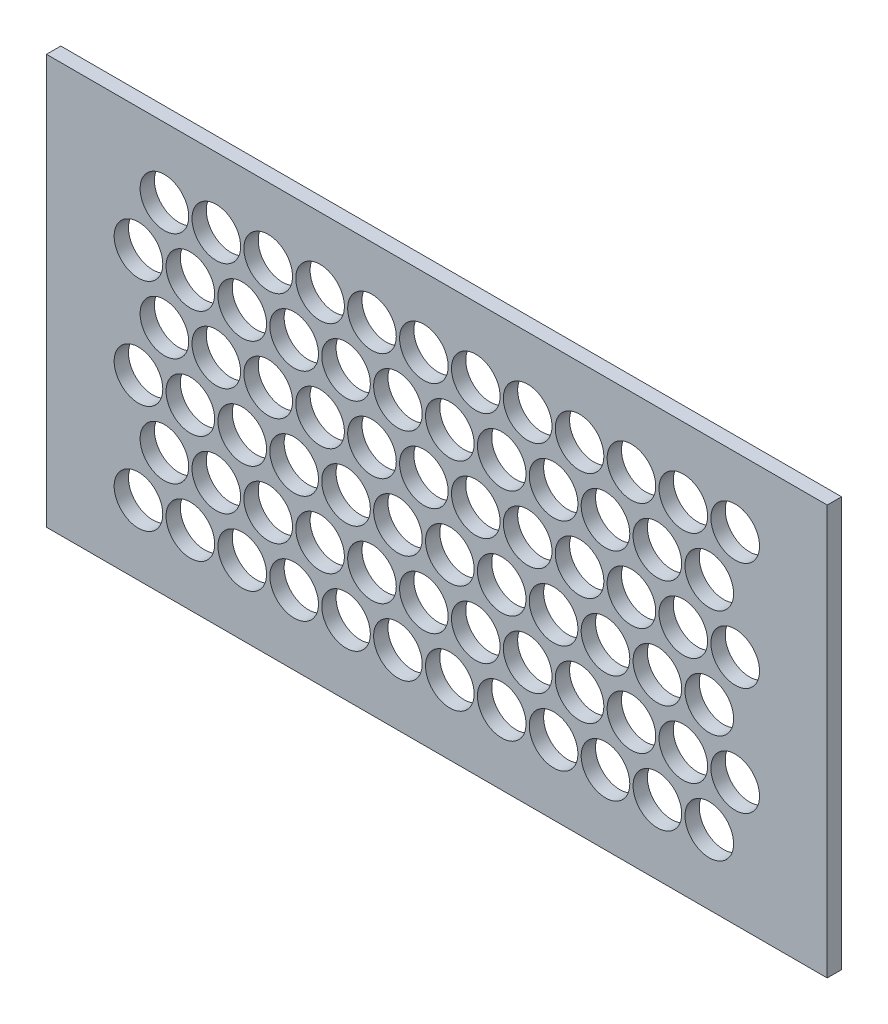
from build123d import *

# Parameters (mm, degrees)
SKETCH1_W                  = 346.05
SKETCH1_H                  = 181.55
BOSS_EXTRUDE1_DEPTH        = 6.35
CUT_EXTRUDE1_DEPTH         = 196.494434064
SKETCH4_R                  = 10.775
CUT_EXTRUDE2_DEPTH         = 196.494434064
LPATTERN1_COUNT            = 12
LPATTERN1_PITCH            = 23
LPATTERN2_COPY_1_DEPTH     = 196.494434064
LPATTERN2_COPY_2_DEPTH     = 196.494434064
LPATTERN2_COPY_3_DEPTH     = 196.494434064
LPATTERN2_COPY_4_DEPTH     = 196.494434064
LPATTERN2_COPY_5_DEPTH     = 196.494434064
LPATTERN2_COPY_6_DEPTH     = 196.494434064
LPATTERN2_COPY_7_DEPTH     = 196.494434064
LPATTERN2_COPY_8_DEPTH     = 196.494434064
LPATTERN2_COPY_9_DEPTH     = 196.494434064
LPATTERN2_COPY_10_DEPTH    = 196.494434064
LPATTERN2_COPY_11_DEPTH    = 196.494434064
LPATTERN2_COPY_12_DEPTH    = 196.494434064
LPATTERN2_COPY_13_DEPTH    = 196.494434064
LPATTERN2_COPY_14_DEPTH    = 196.494434064
LPATTERN2_COPY_15_DEPTH    = 196.494434064
LPATTERN2_COPY_16_DEPTH    = 196.494434064
LPATTERN2_COPY_17_DEPTH    = 196.494434064
LPATTERN2_COPY_18_DEPTH    = 196.494434064
LPATTERN2_COPY_19_DEPTH    = 196.494434064
LPATTERN2_COPY_20_DEPTH    = 196.494434064
LPATTERN2_COPY_21_DEPTH    = 196.494434064
LPATTERN2_COPY_22_DEPTH    = 196.494434064
LPATTERN2_COPY_23_SKETCH_R = 10.775
LPATTERN2_COPY_23_DEPTH    = 196.494434064
LPATTERN2_COPY_24_SKETCH_R = 10.775
LPATTERN2_COPY_24_DEPTH    = 196.494434064
LPATTERN2_COPY_25_SKETCH_R = 10.775
LPATTERN2_COPY_25_DEPTH    = 196.494434064
LPATTERN2_COPY_26_SKETCH_R = 10.775
LPATTERN2_COPY_26_DEPTH    = 196.494434064
LPATTERN2_COPY_27_SKETCH_R = 10.775
LPATTERN2_COPY_27_DEPTH    = 196.494434064
LPATTERN2_COPY_28_SKETCH_R = 10.775
LPATTERN2_COPY_28_DEPTH    = 196.494434064
LPATTERN2_COPY_29_SKETCH_R = 10.775
LPATTERN2_COPY_29_DEPTH    = 196.494434064
LPATTERN2_COPY_30_SKETCH_R = 10.775
LPATTERN2_COPY_30_DEPTH    = 196.494434064
LPATTERN2_COPY_31_SKETCH_R = 10.775
LPATTERN2_COPY_31_DEPTH    = 196.494434064
LPATTERN2_COPY_32_SKETCH_R = 10.775
LPATTERN2_COPY_32_DEPTH    = 196.494434064
LPATTERN2_COPY_33_SKETCH_R = 10.775
LPATTERN2_COPY_33_DEPTH    = 196.494434064
LPATTERN2_COPY_34_SKETCH_R = 10.775
LPATTERN2_COPY_34_DEPTH    = 196.494434064
LPATTERN2_COPY_35_SKETCH_R = 10.775
LPATTERN2_COPY_35_DEPTH    = 196.494434064
LPATTERN2_COPY_36_SKETCH_R = 10.775
LPATTERN2_COPY_36_DEPTH    = 196.494434064
LPATTERN2_COPY_37_SKETCH_R = 10.775
LPATTERN2_COPY_37_DEPTH    = 196.494434064
LPATTERN2_COPY_38_SKETCH_R = 10.775
LPATTERN2_COPY_38_DEPTH    = 196.494434064
LPATTERN2_COPY_39_SKETCH_R = 10.775
LPATTERN2_COPY_39_DEPTH    = 196.494434064
LPATTERN2_COPY_40_SKETCH_R = 10.775
LPATTERN2_COPY_40_DEPTH    = 196.494434064
LPATTERN2_COPY_41_SKETCH_R = 10.775
LPATTERN2_COPY_41_DEPTH    = 196.494434064
LPATTERN2_COPY_42_SKETCH_R = 10.775
LPATTERN2_COPY_42_DEPTH    = 196.494434064
LPATTERN2_COPY_43_SKETCH_R = 10.775
LPATTERN2_COPY_43_DEPTH    = 196.494434064
LPATTERN2_COPY_44_SKETCH_R = 10.775
LPATTERN2_COPY_44_DEPTH    = 196.494434064
LPATTERN2_COPY_45_DEPTH    = 196.494434064
LPATTERN2_COPY_46_DEPTH    = 196.494434064
LPATTERN2_COPY_47_SKETCH_R = 10.775
LPATTERN2_COPY_47_DEPTH    = 196.494434064
LPATTERN2_COPY_48_SKETCH_R = 10.775
LPATTERN2_COPY_48_DEPTH    = 196.494434064


with BuildPart() as part:
    # Sketch1 → Boss-Extrude1 (new body)
    with BuildSketch(Plane.XY):
        Rectangle(SKETCH1_W, SKETCH1_H)
    extrude(amount=BOSS_EXTRUDE1_DEPTH)

    # Sketch3 → Cut-Extrude1 (cut, through all)
    with BuildSketch(Plane.XY.offset(6.35)):
        with BuildLine():
            ThreePointArc((-121.475, -60), (-132.24999993, -49.225), (-143.025, -59.999999859))
            ThreePointArc((-143.025, -59.999999859), (-139.869075617, -67.619075517), (-132.25, -70.775))
            ThreePointArc((-132.25, -70.775), (-124.630924433, -67.619075567), (-121.475, -60))
        make_face()
    cut_extrude1 = extrude(amount=-CUT_EXTRUDE1_DEPTH, mode=Mode.SUBTRACT)

    # Sketch4 → Cut-Extrude2 (cut, through all)
    with BuildSketch(Plane.XY.offset(6.35)):
        with Locations((-120.75, -36)):
            Circle(SKETCH4_R)
    cut_extrude2 = extrude(amount=-CUT_EXTRUDE2_DEPTH, mode=Mode.SUBTRACT)

    # LPattern1: Cut-Extrude1, Cut-Extrude2 ×12
    with Locations(*[(i * LPATTERN1_PITCH, 0, 0) for i in range(1, LPATTERN1_COUNT)]):
        add(cut_extrude1, mode=Mode.SUBTRACT)
        add(cut_extrude2, mode=Mode.SUBTRACT)

    # LPattern2 copy 1 sketch → LPattern2 copy 1 (cut, through all)
    with BuildSketch(Plane(origin=(23, 48, 6.35), x_dir=(1, 0, 0), z_dir=(0, 0, 1))):
        with BuildLine():
            ThreePointArc((-121.475, -60), (-132.24999993, -49.225), (-143.025, -59.999999859))
            ThreePointArc((-143.025, -59.999999859), (-139.869075617, -67.619075517), (-132.25, -70.775))
            ThreePointArc((-132.25, -70.775), (-124.630924433, -67.619075567), (-121.475, -60))
        make_face()
    extrude(amount=-LPATTERN2_COPY_1_DEPTH, mode=Mode.SUBTRACT)

    # LPattern2 copy 2 sketch → LPattern2 copy 2 (cut, through all)
    with BuildSketch(Plane(origin=(23, 96, 6.35), x_dir=(1, 0, 0), z_dir=(0, 0, 1))):
        with BuildLine():
            ThreePointArc((-121.475, -60), (-132.24999993, -49.225), (-143.025, -59.999999859))
            ThreePointArc((-143.025, -59.999999859), (-139.869075617, -67.619075517), (-132.25, -70.775))
            ThreePointArc((-132.25, -70.775), (-124.630924433, -67.619075567), (-121.475, -60))
        make_face()
    extrude(amount=-LPATTERN2_COPY_2_DEPTH, mode=Mode.SUBTRACT)

    # LPattern2 copy 3 sketch → LPattern2 copy 3 (cut, through all)
    with BuildSketch(Plane(origin=(46, 48, 6.35), x_dir=(1, 0, 0), z_dir=(0, 0, 1))):
        with BuildLine():
            ThreePointArc((-121.475, -60), (-132.24999993, -49.225), (-143.025, -59.999999859))
            ThreePointArc((-143.025, -59.999999859), (-139.869075617, -67.619075517), (-132.25, -70.775))
            ThreePointArc((-132.25, -70.775), (-124.630924433, -67.619075567), (-121.475, -60))
        make_face()
    extrude(amount=-LPATTERN2_COPY_3_DEPTH, mode=Mode.SUBTRACT)

    # LPattern2 copy 4 sketch → LPattern2 copy 4 (cut, through all)
    with BuildSketch(Plane(origin=(46, 96, 6.35), x_dir=(1, 0, 0), z_dir=(0, 0, 1))):
        with BuildLine():
            ThreePointArc((-121.475, -60), (-132.24999993, -49.225), (-143.025, -59.999999859))
            ThreePointArc((-143.025, -59.999999859), (-139.869075617, -67.619075517), (-132.25, -70.775))
            ThreePointArc((-132.25, -70.775), (-124.630924433, -67.619075567), (-121.475, -60))
        make_face()
    extrude(amount=-LPATTERN2_COPY_4_DEPTH, mode=Mode.SUBTRACT)

    # LPattern2 copy 5 sketch → LPattern2 copy 5 (cut, through all)
    with BuildSketch(Plane(origin=(69, 48, 6.35), x_dir=(1, 0, 0), z_dir=(0, 0, 1))):
        with BuildLine():
            ThreePointArc((-121.475, -60), (-132.24999993, -49.225), (-143.025, -59.999999859))
            ThreePointArc((-143.025, -59.999999859), (-139.869075617, -67.619075517), (-132.25, -70.775))
            ThreePointArc((-132.25, -70.775), (-124.630924433, -67.619075567), (-121.475, -60))
        make_face()
    extrude(amount=-LPATTERN2_COPY_5_DEPTH, mode=Mode.SUBTRACT)

    # LPattern2 copy 6 sketch → LPattern2 copy 6 (cut, through all)
    with BuildSketch(Plane(origin=(69, 96, 6.35), x_dir=(1, 0, 0), z_dir=(0, 0, 1))):
        with BuildLine():
            ThreePointArc((-121.475, -60), (-132.24999993, -49.225), (-143.025, -59.999999859))
            ThreePointArc((-143.025, -59.999999859), (-139.869075617, -67.619075517), (-132.25, -70.775))
            ThreePointArc((-132.25, -70.775), (-124.630924433, -67.619075567), (-121.475, -60))
        make_face()
    extrude(amount=-LPATTERN2_COPY_6_DEPTH, mode=Mode.SUBTRACT)

    # LPattern2 copy 7 sketch → LPattern2 copy 7 (cut, through all)
    with BuildSketch(Plane(origin=(92, 48, 6.35), x_dir=(1, 0, 0), z_dir=(0, 0, 1))):
        with BuildLine():
            ThreePointArc((-121.475, -60), (-132.24999993, -49.225), (-143.025, -59.999999859))
            ThreePointArc((-143.025, -59.999999859), (-139.869075617, -67.619075517), (-132.25, -70.775))
            ThreePointArc((-132.25, -70.775), (-124.630924433, -67.619075567), (-121.475, -60))
        make_face()
    extrude(amount=-LPATTERN2_COPY_7_DEPTH, mode=Mode.SUBTRACT)

    # LPattern2 copy 8 sketch → LPattern2 copy 8 (cut, through all)
    with BuildSketch(Plane(origin=(92, 96, 6.35), x_dir=(1, 0, 0), z_dir=(0, 0, 1))):
        with BuildLine():
            ThreePointArc((-121.475, -60), (-132.24999993, -49.225), (-143.025, -59.999999859))
            ThreePointArc((-143.025, -59.999999859), (-139.869075617, -67.619075517), (-132.25, -70.775))
            ThreePointArc((-132.25, -70.775), (-124.630924433, -67.619075567), (-121.475, -60))
        make_face()
    extrude(amount=-LPATTERN2_COPY_8_DEPTH, mode=Mode.SUBTRACT)

    # LPattern2 copy 9 sketch → LPattern2 copy 9 (cut, through all)
    with BuildSketch(Plane(origin=(115, 48, 6.35), x_dir=(1, 0, 0), z_dir=(0, 0, 1))):
        with BuildLine():
            ThreePointArc((-121.475, -60), (-132.24999993, -49.225), (-143.025, -59.999999859))
            ThreePointArc((-143.025, -59.999999859), (-139.869075617, -67.619075517), (-132.25, -70.775))
            ThreePointArc((-132.25, -70.775), (-124.630924433, -67.619075567), (-121.475, -60))
        make_face()
    extrude(amount=-LPATTERN2_COPY_9_DEPTH, mode=Mode.SUBTRACT)

    # LPattern2 copy 10 sketch → LPattern2 copy 10 (cut, through all)
    with BuildSketch(Plane(origin=(115, 96, 6.35), x_dir=(1, 0, 0), z_dir=(0, 0, 1))):
        with BuildLine():
            ThreePointArc((-121.475, -60), (-132.24999993, -49.225), (-143.025, -59.999999859))
            ThreePointArc((-143.025, -59.999999859), (-139.869075617, -67.619075517), (-132.25, -70.775))
            ThreePointArc((-132.25, -70.775), (-124.630924433, -67.619075567), (-121.475, -60))
        make_face()
    extrude(amount=-LPATTERN2_COPY_10_DEPTH, mode=Mode.SUBTRACT)

    # LPattern2 copy 11 sketch → LPattern2 copy 11 (cut, through all)
    with BuildSketch(Plane(origin=(138, 48, 6.35), x_dir=(1, 0, 0), z_dir=(0, 0, 1))):
        with BuildLine():
            ThreePointArc((-121.475, -60), (-132.24999993, -49.225), (-143.025, -59.999999859))
            ThreePointArc((-143.025, -59.999999859), (-139.869075617, -67.619075517), (-132.25, -70.775))
            ThreePointArc((-132.25, -70.775), (-124.630924433, -67.619075567), (-121.475, -60))
        make_face()
    extrude(amount=-LPATTERN2_COPY_11_DEPTH, mode=Mode.SUBTRACT)

    # LPattern2 copy 12 sketch → LPattern2 copy 12 (cut, through all)
    with BuildSketch(Plane(origin=(138, 96, 6.35), x_dir=(1, 0, 0), z_dir=(0, 0, 1))):
        with BuildLine():
            ThreePointArc((-121.475, -60), (-132.24999993, -49.225), (-143.025, -59.999999859))
            ThreePointArc((-143.025, -59.999999859), (-139.869075617, -67.619075517), (-132.25, -70.775))
            ThreePointArc((-132.25, -70.775), (-124.630924433, -67.619075567), (-121.475, -60))
        make_face()
    extrude(amount=-LPATTERN2_COPY_12_DEPTH, mode=Mode.SUBTRACT)

    # LPattern2 copy 13 sketch → LPattern2 copy 13 (cut, through all)
    with BuildSketch(Plane(origin=(161, 48, 6.35), x_dir=(1, 0, 0), z_dir=(0, 0, 1))):
        with BuildLine():
            ThreePointArc((-121.475, -60), (-132.24999993, -49.225), (-143.025, -59.999999859))
            ThreePointArc((-143.025, -59.999999859), (-139.869075617, -67.619075517), (-132.25, -70.775))
            ThreePointArc((-132.25, -70.775), (-124.630924433, -67.619075567), (-121.475, -60))
        make_face()
    extrude(amount=-LPATTERN2_COPY_13_DEPTH, mode=Mode.SUBTRACT)

    # LPattern2 copy 14 sketch → LPattern2 copy 14 (cut, through all)
    with BuildSketch(Plane(origin=(161, 96, 6.35), x_dir=(1, 0, 0), z_dir=(0, 0, 1))):
        with BuildLine():
            ThreePointArc((-121.475, -60), (-132.24999993, -49.225), (-143.025, -59.999999859))
            ThreePointArc((-143.025, -59.999999859), (-139.869075617, -67.619075517), (-132.25, -70.775))
            ThreePointArc((-132.25, -70.775), (-124.630924433, -67.619075567), (-121.475, -60))
        make_face()
    extrude(amount=-LPATTERN2_COPY_14_DEPTH, mode=Mode.SUBTRACT)

    # LPattern2 copy 15 sketch → LPattern2 copy 15 (cut, through all)
    with BuildSketch(Plane(origin=(184, 48, 6.35), x_dir=(1, 0, 0), z_dir=(0, 0, 1))):
        with BuildLine():
            ThreePointArc((-121.475, -60), (-132.24999993, -49.225), (-143.025, -59.999999859))
            ThreePointArc((-143.025, -59.999999859), (-139.869075617, -67.619075517), (-132.25, -70.775))
            ThreePointArc((-132.25, -70.775), (-124.630924433, -67.619075567), (-121.475, -60))
        make_face()
    extrude(amount=-LPATTERN2_COPY_15_DEPTH, mode=Mode.SUBTRACT)

    # LPattern2 copy 16 sketch → LPattern2 copy 16 (cut, through all)
    with BuildSketch(Plane(origin=(184, 96, 6.35), x_dir=(1, 0, 0), z_dir=(0, 0, 1))):
        with BuildLine():
            ThreePointArc((-121.475, -60), (-132.24999993, -49.225), (-143.025, -59.999999859))
            ThreePointArc((-143.025, -59.999999859), (-139.869075617, -67.619075517), (-132.25, -70.775))
            ThreePointArc((-132.25, -70.775), (-124.630924433, -67.619075567), (-121.475, -60))
        make_face()
    extrude(amount=-LPATTERN2_COPY_16_DEPTH, mode=Mode.SUBTRACT)

    # LPattern2 copy 17 sketch → LPattern2 copy 17 (cut, through all)
    with BuildSketch(Plane(origin=(207, 48, 6.35), x_dir=(1, 0, 0), z_dir=(0, 0, 1))):
        with BuildLine():
            ThreePointArc((-121.475, -60), (-132.24999993, -49.225), (-143.025, -59.999999859))
            ThreePointArc((-143.025, -59.999999859), (-139.869075617, -67.619075517), (-132.25, -70.775))
            ThreePointArc((-132.25, -70.775), (-124.630924433, -67.619075567), (-121.475, -60))
        make_face()
    extrude(amount=-LPATTERN2_COPY_17_DEPTH, mode=Mode.SUBTRACT)

    # LPattern2 copy 18 sketch → LPattern2 copy 18 (cut, through all)
    with BuildSketch(Plane(origin=(207, 96, 6.35), x_dir=(1, 0, 0), z_dir=(0, 0, 1))):
        with BuildLine():
            ThreePointArc((-121.475, -60), (-132.24999993, -49.225), (-143.025, -59.999999859))
            ThreePointArc((-143.025, -59.999999859), (-139.869075617, -67.619075517), (-132.25, -70.775))
            ThreePointArc((-132.25, -70.775), (-124.630924433, -67.619075567), (-121.475, -60))
        make_face()
    extrude(amount=-LPATTERN2_COPY_18_DEPTH, mode=Mode.SUBTRACT)

    # LPattern2 copy 19 sketch → LPattern2 copy 19 (cut, through all)
    with BuildSketch(Plane(origin=(230, 48, 6.35), x_dir=(1, 0, 0), z_dir=(0, 0, 1))):
        with BuildLine():
            ThreePointArc((-121.475, -60), (-132.24999993, -49.225), (-143.025, -59.999999859))
            ThreePointArc((-143.025, -59.999999859), (-139.869075617, -67.619075517), (-132.25, -70.775))
            ThreePointArc((-132.25, -70.775), (-124.630924433, -67.619075567), (-121.475, -60))
        make_face()
    extrude(amount=-LPATTERN2_COPY_19_DEPTH, mode=Mode.SUBTRACT)

    # LPattern2 copy 20 sketch → LPattern2 copy 20 (cut, through all)
    with BuildSketch(Plane(origin=(230, 96, 6.35), x_dir=(1, 0, 0), z_dir=(0, 0, 1))):
        with BuildLine():
            ThreePointArc((-121.475, -60), (-132.24999993, -49.225), (-143.025, -59.999999859))
            ThreePointArc((-143.025, -59.999999859), (-139.869075617, -67.619075517), (-132.25, -70.775))
            ThreePointArc((-132.25, -70.775), (-124.630924433, -67.619075567), (-121.475, -60))
        make_face()
    extrude(amount=-LPATTERN2_COPY_20_DEPTH, mode=Mode.SUBTRACT)

    # LPattern2 copy 21 sketch → LPattern2 copy 21 (cut, through all)
    with BuildSketch(Plane(origin=(253, 48, 6.35), x_dir=(1, 0, 0), z_dir=(0, 0, 1))):
        with BuildLine():
            ThreePointArc((-121.475, -60), (-132.24999993, -49.225), (-143.025, -59.999999859))
            ThreePointArc((-143.025, -59.999999859), (-139.869075617, -67.619075517), (-132.25, -70.775))
            ThreePointArc((-132.25, -70.775), (-124.630924433, -67.619075567), (-121.475, -60))
        make_face()
    extrude(amount=-LPATTERN2_COPY_21_DEPTH, mode=Mode.SUBTRACT)

    # LPattern2 copy 22 sketch → LPattern2 copy 22 (cut, through all)
    with BuildSketch(Plane(origin=(253, 96, 6.35), x_dir=(1, 0, 0), z_dir=(0, 0, 1))):
        with BuildLine():
            ThreePointArc((-121.475, -60), (-132.24999993, -49.225), (-143.025, -59.999999859))
            ThreePointArc((-143.025, -59.999999859), (-139.869075617, -67.619075517), (-132.25, -70.775))
            ThreePointArc((-132.25, -70.775), (-124.630924433, -67.619075567), (-121.475, -60))
        make_face()
    extrude(amount=-LPATTERN2_COPY_22_DEPTH, mode=Mode.SUBTRACT)

    # LPattern2 copy 23 sketch → LPattern2 copy 23 (cut, through all)
    with BuildSketch(Plane(origin=(23, 48, 6.35), x_dir=(1, 0, 0), z_dir=(0, 0, 1))):
        with Locations((-120.75, -36)):
            Circle(LPATTERN2_COPY_23_SKETCH_R)
    extrude(amount=-LPATTERN2_COPY_23_DEPTH, mode=Mode.SUBTRACT)

    # LPattern2 copy 24 sketch → LPattern2 copy 24 (cut, through all)
    with BuildSketch(Plane(origin=(23, 96, 6.35), x_dir=(1, 0, 0), z_dir=(0, 0, 1))):
        with Locations((-120.75, -36)):
            Circle(LPATTERN2_COPY_24_SKETCH_R)
    extrude(amount=-LPATTERN2_COPY_24_DEPTH, mode=Mode.SUBTRACT)

    # LPattern2 copy 25 sketch → LPattern2 copy 25 (cut, through all)
    with BuildSketch(Plane(origin=(46, 48, 6.35), x_dir=(1, 0, 0), z_dir=(0, 0, 1))):
        with Locations((-120.75, -36)):
            Circle(LPATTERN2_COPY_25_SKETCH_R)
    extrude(amount=-LPATTERN2_COPY_25_DEPTH, mode=Mode.SUBTRACT)

    # LPattern2 copy 26 sketch → LPattern2 copy 26 (cut, through all)
    with BuildSketch(Plane(origin=(46, 96, 6.35), x_dir=(1, 0, 0), z_dir=(0, 0, 1))):
        with Locations((-120.75, -36)):
            Circle(LPATTERN2_COPY_26_SKETCH_R)
    extrude(amount=-LPATTERN2_COPY_26_DEPTH, mode=Mode.SUBTRACT)

    # LPattern2 copy 27 sketch → LPattern2 copy 27 (cut, through all)
    with BuildSketch(Plane(origin=(69, 48, 6.35), x_dir=(1, 0, 0), z_dir=(0, 0, 1))):
        with Locations((-120.75, -36)):
            Circle(LPATTERN2_COPY_27_SKETCH_R)
    extrude(amount=-LPATTERN2_COPY_27_DEPTH, mode=Mode.SUBTRACT)

    # LPattern2 copy 28 sketch → LPattern2 copy 28 (cut, through all)
    with BuildSketch(Plane(origin=(69, 96, 6.35), x_dir=(1, 0, 0), z_dir=(0, 0, 1))):
        with Locations((-120.75, -36)):
            Circle(LPATTERN2_COPY_28_SKETCH_R)
    extrude(amount=-LPATTERN2_COPY_28_DEPTH, mode=Mode.SUBTRACT)

    # LPattern2 copy 29 sketch → LPattern2 copy 29 (cut, through all)
    with BuildSketch(Plane(origin=(92, 48, 6.35), x_dir=(1, 0, 0), z_dir=(0, 0, 1))):
        with Locations((-120.75, -36)):
            Circle(LPATTERN2_COPY_29_SKETCH_R)
    extrude(amount=-LPATTERN2_COPY_29_DEPTH, mode=Mode.SUBTRACT)

    # LPattern2 copy 30 sketch → LPattern2 copy 30 (cut, through all)
    with BuildSketch(Plane(origin=(92, 96, 6.35), x_dir=(1, 0, 0), z_dir=(0, 0, 1))):
        with Locations((-120.75, -36)):
            Circle(LPATTERN2_COPY_30_SKETCH_R)
    extrude(amount=-LPATTERN2_COPY_30_DEPTH, mode=Mode.SUBTRACT)

    # LPattern2 copy 31 sketch → LPattern2 copy 31 (cut, through all)
    with BuildSketch(Plane(origin=(115, 48, 6.35), x_dir=(1, 0, 0), z_dir=(0, 0, 1))):
        with Locations((-120.75, -36)):
            Circle(LPATTERN2_COPY_31_SKETCH_R)
    extrude(amount=-LPATTERN2_COPY_31_DEPTH, mode=Mode.SUBTRACT)

    # LPattern2 copy 32 sketch → LPattern2 copy 32 (cut, through all)
    with BuildSketch(Plane(origin=(115, 96, 6.35), x_dir=(1, 0, 0), z_dir=(0, 0, 1))):
        with Locations((-120.75, -36)):
            Circle(LPATTERN2_COPY_32_SKETCH_R)
    extrude(amount=-LPATTERN2_COPY_32_DEPTH, mode=Mode.SUBTRACT)

    # LPattern2 copy 33 sketch → LPattern2 copy 33 (cut, through all)
    with BuildSketch(Plane(origin=(138, 48, 6.35), x_dir=(1, 0, 0), z_dir=(0, 0, 1))):
        with Locations((-120.75, -36)):
            Circle(LPATTERN2_COPY_33_SKETCH_R)
    extrude(amount=-LPATTERN2_COPY_33_DEPTH, mode=Mode.SUBTRACT)

    # LPattern2 copy 34 sketch → LPattern2 copy 34 (cut, through all)
    with BuildSketch(Plane(origin=(138, 96, 6.35), x_dir=(1, 0, 0), z_dir=(0, 0, 1))):
        with Locations((-120.75, -36)):
            Circle(LPATTERN2_COPY_34_SKETCH_R)
    extrude(amount=-LPATTERN2_COPY_34_DEPTH, mode=Mode.SUBTRACT)

    # LPattern2 copy 35 sketch → LPattern2 copy 35 (cut, through all)
    with BuildSketch(Plane(origin=(161, 48, 6.35), x_dir=(1, 0, 0), z_dir=(0, 0, 1))):
        with Locations((-120.75, -36)):
            Circle(LPATTERN2_COPY_35_SKETCH_R)
    extrude(amount=-LPATTERN2_COPY_35_DEPTH, mode=Mode.SUBTRACT)

    # LPattern2 copy 36 sketch → LPattern2 copy 36 (cut, through all)
    with BuildSketch(Plane(origin=(161, 96, 6.35), x_dir=(1, 0, 0), z_dir=(0, 0, 1))):
        with Locations((-120.75, -36)):
            Circle(LPATTERN2_COPY_36_SKETCH_R)
    extrude(amount=-LPATTERN2_COPY_36_DEPTH, mode=Mode.SUBTRACT)

    # LPattern2 copy 37 sketch → LPattern2 copy 37 (cut, through all)
    with BuildSketch(Plane(origin=(184, 48, 6.35), x_dir=(1, 0, 0), z_dir=(0, 0, 1))):
        with Locations((-120.75, -36)):
            Circle(LPATTERN2_COPY_37_SKETCH_R)
    extrude(amount=-LPATTERN2_COPY_37_DEPTH, mode=Mode.SUBTRACT)

    # LPattern2 copy 38 sketch → LPattern2 copy 38 (cut, through all)
    with BuildSketch(Plane(origin=(184, 96, 6.35), x_dir=(1, 0, 0), z_dir=(0, 0, 1))):
        with Locations((-120.75, -36)):
            Circle(LPATTERN2_COPY_38_SKETCH_R)
    extrude(amount=-LPATTERN2_COPY_38_DEPTH, mode=Mode.SUBTRACT)

    # LPattern2 copy 39 sketch → LPattern2 copy 39 (cut, through all)
    with BuildSketch(Plane(origin=(207, 48, 6.35), x_dir=(1, 0, 0), z_dir=(0, 0, 1))):
        with Locations((-120.75, -36)):
            Circle(LPATTERN2_COPY_39_SKETCH_R)
    extrude(amount=-LPATTERN2_COPY_39_DEPTH, mode=Mode.SUBTRACT)

    # LPattern2 copy 40 sketch → LPattern2 copy 40 (cut, through all)
    with BuildSketch(Plane(origin=(207, 96, 6.35), x_dir=(1, 0, 0), z_dir=(0, 0, 1))):
        with Locations((-120.75, -36)):
            Circle(LPATTERN2_COPY_40_SKETCH_R)
    extrude(amount=-LPATTERN2_COPY_40_DEPTH, mode=Mode.SUBTRACT)

    # LPattern2 copy 41 sketch → LPattern2 copy 41 (cut, through all)
    with BuildSketch(Plane(origin=(230, 48, 6.35), x_dir=(1, 0, 0), z_dir=(0, 0, 1))):
        with Locations((-120.75, -36)):
            Circle(LPATTERN2_COPY_41_SKETCH_R)
    extrude(amount=-LPATTERN2_COPY_41_DEPTH, mode=Mode.SUBTRACT)

    # LPattern2 copy 42 sketch → LPattern2 copy 42 (cut, through all)
    with BuildSketch(Plane(origin=(230, 96, 6.35), x_dir=(1, 0, 0), z_dir=(0, 0, 1))):
        with Locations((-120.75, -36)):
            Circle(LPATTERN2_COPY_42_SKETCH_R)
    extrude(amount=-LPATTERN2_COPY_42_DEPTH, mode=Mode.SUBTRACT)

    # LPattern2 copy 43 sketch → LPattern2 copy 43 (cut, through all)
    with BuildSketch(Plane(origin=(253, 48, 6.35), x_dir=(1, 0, 0), z_dir=(0, 0, 1))):
        with Locations((-120.75, -36)):
            Circle(LPATTERN2_COPY_43_SKETCH_R)
    extrude(amount=-LPATTERN2_COPY_43_DEPTH, mode=Mode.SUBTRACT)

    # LPattern2 copy 44 sketch → LPattern2 copy 44 (cut, through all)
    with BuildSketch(Plane(origin=(253, 96, 6.35), x_dir=(1, 0, 0), z_dir=(0, 0, 1))):
        with Locations((-120.75, -36)):
            Circle(LPATTERN2_COPY_44_SKETCH_R)
    extrude(amount=-LPATTERN2_COPY_44_DEPTH, mode=Mode.SUBTRACT)

    # LPattern2 copy 45 sketch → LPattern2 copy 45 (cut, through all)
    with BuildSketch(Plane(origin=(0, 48, 6.35), x_dir=(1, 0, 0), z_dir=(0, 0, 1))):
        with BuildLine():
            ThreePointArc((-121.475, -60), (-132.24999993, -49.225), (-143.025, -59.999999859))
            ThreePointArc((-143.025, -59.999999859), (-139.869075617, -67.619075517), (-132.25, -70.775))
            ThreePointArc((-132.25, -70.775), (-124.630924433, -67.619075567), (-121.475, -60))
        make_face()
    extrude(amount=-LPATTERN2_COPY_45_DEPTH, mode=Mode.SUBTRACT)

    # LPattern2 copy 46 sketch → LPattern2 copy 46 (cut, through all)
    with BuildSketch(Plane(origin=(0, 96, 6.35), x_dir=(1, 0, 0), z_dir=(0, 0, 1))):
        with BuildLine():
            ThreePointArc((-121.475, -60), (-132.24999993, -49.225), (-143.025, -59.999999859))
            ThreePointArc((-143.025, -59.999999859), (-139.869075617, -67.619075517), (-132.25, -70.775))
            ThreePointArc((-132.25, -70.775), (-124.630924433, -67.619075567), (-121.475, -60))
        make_face()
    extrude(amount=-LPATTERN2_COPY_46_DEPTH, mode=Mode.SUBTRACT)

    # LPattern2 copy 47 sketch → LPattern2 copy 47 (cut, through all)
    with BuildSketch(Plane(origin=(0, 48, 6.35), x_dir=(1, 0, 0), z_dir=(0, 0, 1))):
        with Locations((-120.75, -36)):
            Circle(LPATTERN2_COPY_47_SKETCH_R)
    extrude(amount=-LPATTERN2_COPY_47_DEPTH, mode=Mode.SUBTRACT)

    # LPattern2 copy 48 sketch → LPattern2 copy 48 (cut, through all)
    with BuildSketch(Plane(origin=(0, 96, 6.35), x_dir=(1, 0, 0), z_dir=(0, 0, 1))):
        with Locations((-120.75, -36)):
            Circle(LPATTERN2_COPY_48_SKETCH_R)
    extrude(amount=-LPATTERN2_COPY_48_DEPTH, mode=Mode.SUBTRACT)


solid = part.part
